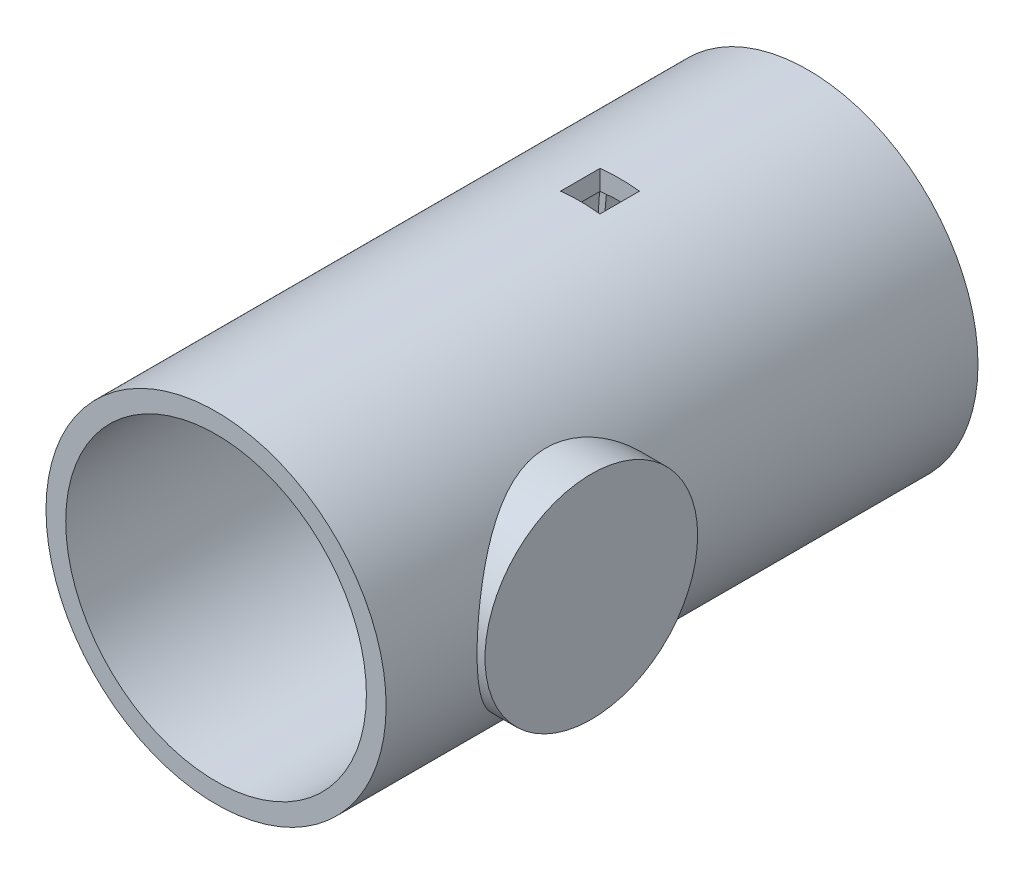
from build123d import *

# Parameters (mm, degrees)
SKETCH1_R           = 43.1
BOSS_EXTRUDE1_DEPTH = 150
SKETCH6_W           = 10
SKETCH6_H           = 10
CUT_EXTRUDE3_DEPTH  = 179.292035717
SKETCH8_R           = 26.95
BOSS_EXTRUDE2_DEPTH = 20
SKETCH5_R           = 31.75
CUT_EXTRUDE4_DEPTH  = 163.454978525
SKETCH2_R           = 38.1
CUT_EXTRUDE5_DEPTH  = 145
BOSS_EXTRUDE3_START = 10
SKETCH9_R           = 38.1
SKETCH9_R_2         = 36.44
BOSS_EXTRUDE3_DEPTH = 10


with BuildPart() as part:
    # Sketch1 → Boss-Extrude1 (new body)
    with BuildSketch(Plane.XY):
        Circle(SKETCH1_R)
    extrude(amount=BOSS_EXTRUDE1_DEPTH)

    # Sketch6 → Cut-Extrude3 (cut, through all)
    with BuildSketch(Plane(origin=(0, 43.1, 0), x_dir=(1, 0, 0), z_dir=(0, 1, 0))):
        with Locations((0, -52.7)):
            Rectangle(SKETCH6_W, SKETCH6_H)
    extrude(amount=-CUT_EXTRUDE3_DEPTH, mode=Mode.SUBTRACT)

    # Sketch8 → Boss-Extrude2 (add)
    with BuildSketch(Plane(origin=(45.1, 0, 0), x_dir=(0, 0, -1), z_dir=(1, 0, 0))):
        with Locations((-100, 0)):
            Circle(SKETCH8_R)
    extrude(amount=-BOSS_EXTRUDE2_DEPTH)

    # Sketch5 → Cut-Extrude4 (cut, through all)
    with BuildSketch(Plane.XY.offset(150)):
        Circle(SKETCH5_R)
    extrude(amount=-CUT_EXTRUDE4_DEPTH, mode=Mode.SUBTRACT)

    # Sketch2 → Cut-Extrude5 (cut)
    with BuildSketch(Plane.XY.offset(150)):
        Circle(SKETCH2_R)
    extrude(amount=-CUT_EXTRUDE5_DEPTH, mode=Mode.SUBTRACT)

    # Sketch9 → Boss-Extrude3 (add)
    with BuildSketch(Plane.XY.offset(5).offset(BOSS_EXTRUDE3_START)):
        Circle(SKETCH9_R)
        Circle(SKETCH9_R_2, mode=Mode.SUBTRACT)
    extrude(amount=-BOSS_EXTRUDE3_DEPTH)


solid = part.part
